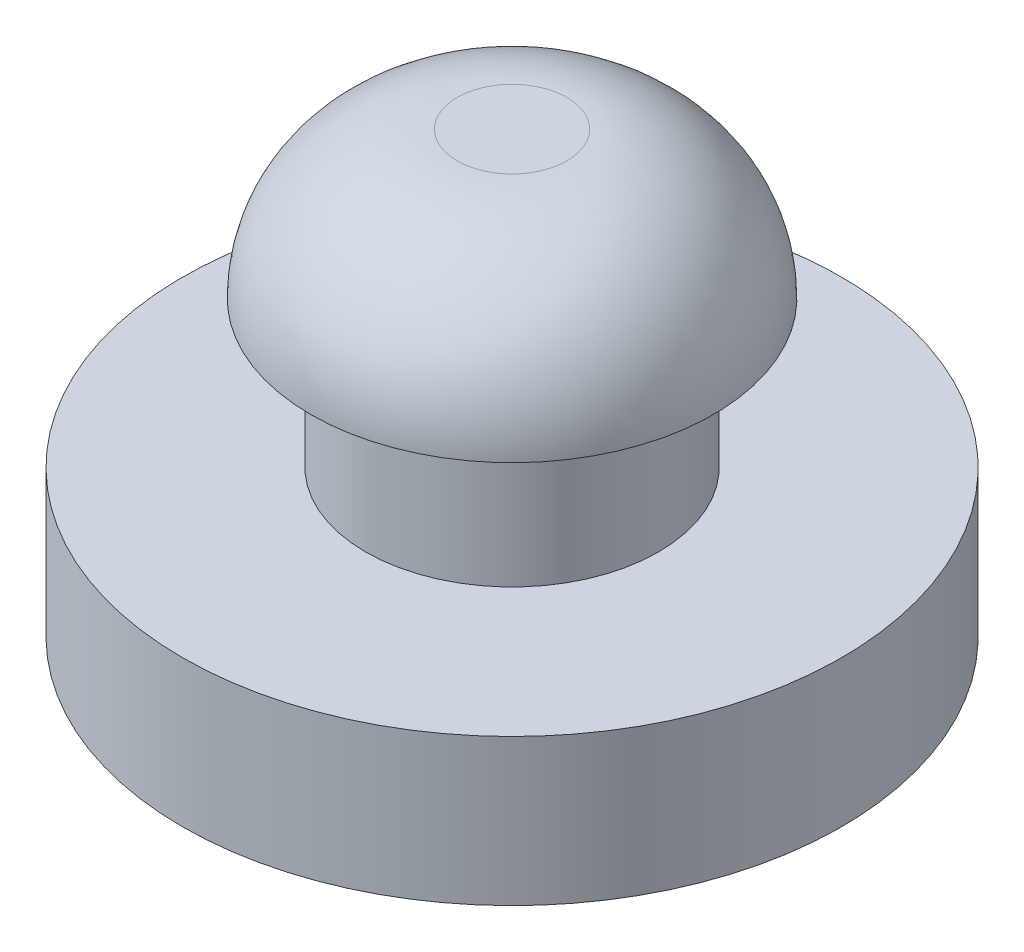
from build123d import *

# Parameters (mm, degrees)
SKETCH1_R           = 7.14375
BOSS_EXTRUDE1_DEPTH = 3.175
SKETCH2_R           = 3.175
BOSS_EXTRUDE2_DEPTH = 3.175
SKETCH3_R           = 4.365625
BOSS_EXTRUDE3_DEPTH = 3.175
FILLET1_R           = 3.175


with BuildPart() as part:
    # Sketch1 → Boss-Extrude1 (new body)
    with BuildSketch(Plane(origin=(0, 0, 0), x_dir=(1, 0, 0), z_dir=(0, 1, 0))):
        with Locations(Location((0, 0, 0), (0, 0, 270))):
            Circle(SKETCH1_R)
    extrude(amount=BOSS_EXTRUDE1_DEPTH)

    # Sketch2 → Boss-Extrude2 (add)
    with BuildSketch(Plane(origin=(0, 3.175, 0), x_dir=(1, 0, 0), z_dir=(0, 1, 0))):
        with Locations(Location((0, 0, 0), (0, 0, 270))):
            Circle(SKETCH2_R)
    extrude(amount=BOSS_EXTRUDE2_DEPTH)

    # Sketch3 → Boss-Extrude3 (add)
    with BuildSketch(Plane(origin=(0, 6.35, 0), x_dir=(1, 0, 0), z_dir=(0, 1, 0))):
        with Locations(Location((0, 0, 0), (0, 0, 270))):
            Circle(SKETCH3_R)
    extrude(amount=BOSS_EXTRUDE3_DEPTH)

    # Fillet1
    fillet1_edges = [part.edges().sort_by_distance(p)[0] for p in [
        (0, 9.525, -4.365625),
    ]]
    fillet(fillet1_edges, radius=FILLET1_R - 0.0001)  # a hair under: the kernel refuses the full size


solid = part.part
